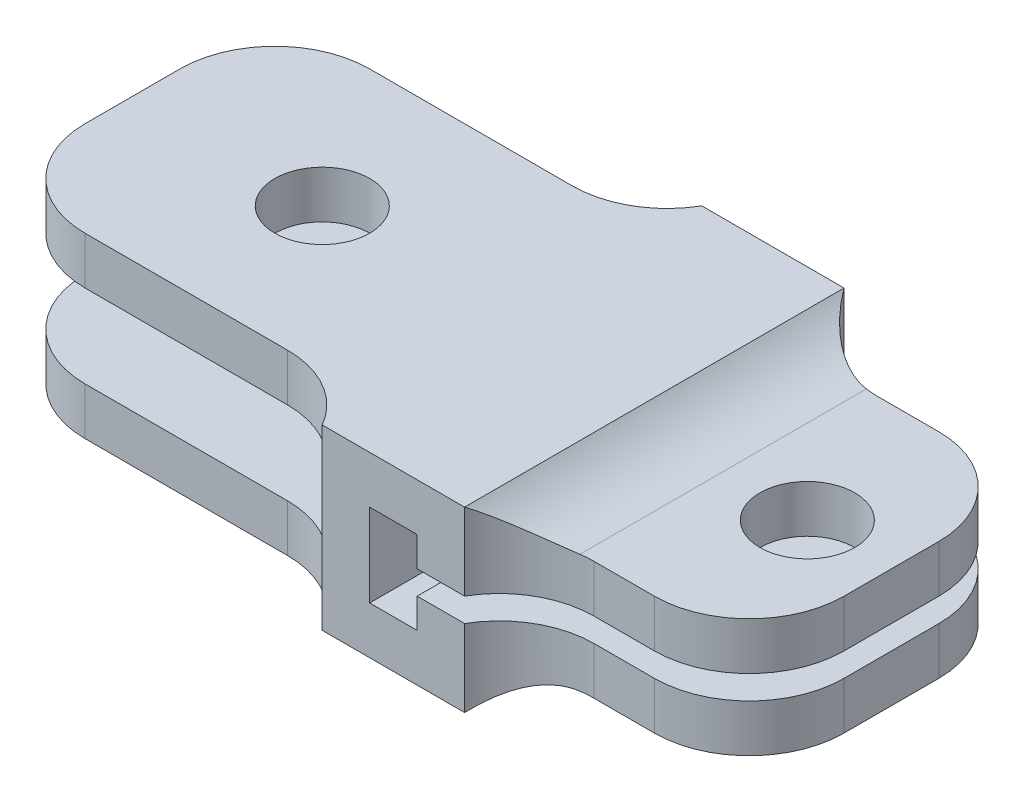
from build123d import *

# Parameters (mm, degrees)
SCHIZZO1_W                    = 15
SCHIZZO1_H                    = 18.75
SCHIZZO1_W_2                  = 5
SCHIZZO1_H_2                  = 8.75
ESTRUSIONE_ESTRUSIONE1_DEPTH  = 40
TAGLIO_ESTRUSIONE1_DEPTH      = 42.762909681
TAGLIO_ESTRUSIONE1_DEPTH_BACK = 42.762909681
SCHIZZO2_W                    = 5
SCHIZZO2_H                    = 2.5
SCHIZZO4_W                    = 30
SCHIZZO4_H                    = 5
ESTRUSIONE_ESTRUSIONE2_DEPTH  = 40
RACCORDO1_R                   = 10
SCHIZZO5_W                    = 30
SCHIZZO5_H                    = 5
ESTRUSIONE_ESTRUSIONE3_DEPTH  = 25
RACCORDO2_R                   = 10
RACCORDO3_R                   = 10
RACCORDO4_R                   = 10
RACCORDO5_R                   = 10
TAGLIO_ESTRUSIONE2_DEPTH      = 65.034292657
TAGLIO_ESTRUSIONE2_DEPTH_BACK = 65.034292657
SCHIZZO6_R                    = 5
TAGLIO_ESTRUSIONE3_DEPTH      = 65.867653817
TAGLIO_ESTRUSIONE3_DEPTH_BACK = 65.867653817
SCHIZZO7_R                    = 5


with BuildPart() as part:
    # Schizzo1 → Estrusione-Estrusione1 (new body)
    with BuildSketch(Plane.XY):
        Rectangle(SCHIZZO1_W, SCHIZZO1_H)
        Rectangle(SCHIZZO1_W_2, SCHIZZO1_H_2, mode=Mode.SUBTRACT)
    extrude(amount=ESTRUSIONE_ESTRUSIONE1_DEPTH)

    # Schizzo2 → Taglio-Estrusione1 (cut, two sides: drawn at the far end of the back side and taken through both)
    with BuildSketch(Plane.XY.offset(40).offset(-TAGLIO_ESTRUSIONE1_DEPTH_BACK)):
        with Locations((5, 0)):
            Rectangle(SCHIZZO2_W, SCHIZZO2_H)
    extrude(amount=TAGLIO_ESTRUSIONE1_DEPTH + TAGLIO_ESTRUSIONE1_DEPTH_BACK, mode=Mode.SUBTRACT)

    # Schizzo4 → Estrusione-Estrusione2 (add)
    with BuildSketch(Plane.ZY.offset(7.5)):
        with Locations((20, 6.875)):
            Rectangle(SCHIZZO4_W, SCHIZZO4_H)
        with Locations((20, -6.875)):
            Rectangle(SCHIZZO4_W, SCHIZZO4_H)
    extrude(amount=ESTRUSIONE_ESTRUSIONE2_DEPTH)

    # Raccordo1
    raccordo1_edges = [part.edges().sort_by_distance(p)[0] for p in [
        (-47.5, 6.875, 5),
        (-47.5, 6.875, 35),
        (-47.5, -6.875, 35),
        (-47.5, -6.875, 5),
    ]]
    fillet(raccordo1_edges, radius=RACCORDO1_R)

    # Schizzo5 → Estrusione-Estrusione3 (add)
    with BuildSketch(Plane(origin=(7.5, 0, 0), x_dir=(0, 0, -1), z_dir=(1, 0, 0))):
        with Locations((-20, 3.75)):
            Rectangle(SCHIZZO5_W, SCHIZZO5_H)
        with Locations((-20, -3.75)):
            Rectangle(SCHIZZO5_W, SCHIZZO5_H)
    extrude(amount=ESTRUSIONE_ESTRUSIONE3_DEPTH)

    # Raccordo2
    raccordo2_edges = [part.edges().sort_by_distance(p)[0] for p in [
        (32.5, 3.75, 35),
        (32.5, 3.75, 5),
        (32.5, -3.75, 35),
        (32.5, -3.75, 5),
    ]]
    fillet(raccordo2_edges, radius=RACCORDO2_R)

    # Raccordo3
    # the kernel refuses this fillet: 10 mm, written as the material it adds along each edge
    with BuildSketch(Plane(origin=(7.5, -6.25, 5), x_dir=(0, 0, -1), z_dir=(0, 1, 0)), Plane(origin=(7.5, 1.25, 5), x_dir=(0, 0, -1), z_dir=(0, 1, 0)), Plane(origin=(7.5, 6.25, 35), x_dir=(0, 0, 1), z_dir=(0, -1, 0))) as raccordo3_piece_1:
        with BuildLine():
            CenterArc((10, -8.660254038), RACCORDO3_R, 120, 60)
            Line((0, -8.660254038), (-0.2, -8.660254038))
            Line((-0.2, -8.660254038), (-0.2, 0))
            Line((-0.2, 0), (0, 0.2))
            ThreePointArc((0, 0.2), (2.5, 0.2), (4.9, 0.173205081))
            Line((4.9, 0.173205081), (5, 0))
        make_face()
    extrude(amount=5)
    with BuildSketch(Plane(origin=(7.5, -6.25, 5), x_dir=(0, 0, -1), z_dir=(0, 1, 0))) as raccordo3_piece_2_section:
        with BuildLine():
            CenterArc((10, -8.660254038), RACCORDO3_R, 120, 60)
            Line((0, -8.660254038), (-0.2, -8.660254038))
            Line((-0.2, -8.660254038), (-0.2, 0))
            Line((-0.2, 0), (0, 0.2))
            ThreePointArc((0, 0.2), (2.5, 0.2), (4.9, 0.173205081))
            Line((4.9, 0.173205081), (5, 0))
        make_face()
    raccordo3_piece_2 = extrude(amount=26.650635095, mode=Mode.PRIVATE)
    raccordo3_piece_2 = split(raccordo3_piece_2, bisect_by=Plane(origin=(9.663104458, 1.25, 3.704832889), z_dir=(0, 1, 0)), keep=Keep.TOP, mode=Mode.PRIVATE)
    raccordo3_piece_2 = split(raccordo3_piece_2, bisect_by=Plane(origin=(9.663104458, 6.25, 3.704832889), z_dir=(0, -1, 0)), keep=Keep.TOP, mode=Mode.PRIVATE)
    add(raccordo3_piece_2)
    with BuildSketch(Plane(origin=(7.5, -20.400635095, 5), x_dir=(0, 0, -1), z_dir=(0, 1, 0))) as raccordo3_piece_3_section:
        with BuildLine():
            CenterArc((10, -8.660254038), RACCORDO3_R, 120, 60)
            Line((0, -8.660254038), (-0.2, -8.660254038))
            Line((-0.2, -8.660254038), (-0.2, 0))
            Line((-0.2, 0), (0, 0.2))
            ThreePointArc((0, 0.2), (2.5, 0.2), (4.9, 0.173205081))
            Line((4.9, 0.173205081), (5, 0))
        make_face()
    raccordo3_piece_3 = extrude(amount=26.650635095, mode=Mode.PRIVATE)
    raccordo3_piece_3 = split(raccordo3_piece_3, bisect_by=Plane(origin=(9.663104458, -1.25, 3.704832889), z_dir=(0, -1, 0)), keep=Keep.TOP, mode=Mode.PRIVATE)
    raccordo3_piece_3 = split(raccordo3_piece_3, bisect_by=Plane(origin=(9.663104458, -6.25, 3.704832889), z_dir=(0, 1, 0)), keep=Keep.TOP, mode=Mode.PRIVATE)
    add(raccordo3_piece_3)
    with BuildSketch(Plane(origin=(7.5, 20.400635095, 35), x_dir=(1, 0, 0), z_dir=(0, -1, 0))) as raccordo3_piece_4_section:
        with BuildLine():
            CenterArc((8.660254038, 10), RACCORDO3_R, 210, 60)
            Line((0, 5), (-0.173205081, 4.9))
            ThreePointArc((-0.173205081, 4.9), (-0.2, 2.5), (-0.2, 0))
            Line((-0.2, 0), (0, -0.2))
            Line((0, -0.2), (8.660254038, -0.2))
            Line((8.660254038, -0.2), (8.660254038, 0))
        make_face()
    raccordo3_piece_4 = extrude(amount=26.650635095, mode=Mode.PRIVATE)
    raccordo3_piece_4 = split(raccordo3_piece_4, bisect_by=Plane(origin=(9.663104458, 1.25, 36.295167111), z_dir=(0, 1, 0)), keep=Keep.TOP, mode=Mode.PRIVATE)
    raccordo3_piece_4 = split(raccordo3_piece_4, bisect_by=Plane(origin=(9.663104458, 6.25, 36.295167111), z_dir=(0, -1, 0)), keep=Keep.TOP, mode=Mode.PRIVATE)
    add(raccordo3_piece_4)
    with BuildSketch(Plane(origin=(7.5, -1.25, 35), x_dir=(1, 0, 0), z_dir=(0, -1, 0))) as raccordo3_piece_5:
        with BuildLine():
            CenterArc((8.660254038, 10), RACCORDO3_R, 210, 60)
            Line((0, 5), (-0.173205081, 4.9))
            ThreePointArc((-0.173205081, 4.9), (-0.2, 2.5), (-0.2, 0))
            Line((-0.2, 0), (0, -0.2))
            Line((0, -0.2), (8.660254038, -0.2))
            Line((8.660254038, -0.2), (8.660254038, 0))
        make_face()
    extrude(amount=5)
    with BuildSketch(Plane(origin=(7.5, 6.25, 35), x_dir=(0, 0, 1), z_dir=(0, -1, 0))) as raccordo3_piece_6_section:
        with BuildLine():
            CenterArc((10, -8.660254038), RACCORDO3_R, 120, 60)
            Line((0, -8.660254038), (-0.2, -8.660254038))
            Line((-0.2, -8.660254038), (-0.2, 0))
            Line((-0.2, 0), (0, 0.2))
            ThreePointArc((0, 0.2), (2.5, 0.2), (4.9, 0.173205081))
            Line((4.9, 0.173205081), (5, 0))
        make_face()
    raccordo3_piece_6 = extrude(amount=26.650635095, mode=Mode.PRIVATE)
    raccordo3_piece_6 = split(raccordo3_piece_6, bisect_by=Plane(origin=(9.663104458, -1.25, 36.295167111), z_dir=(0, -1, 0)), keep=Keep.TOP, mode=Mode.PRIVATE)
    raccordo3_piece_6 = split(raccordo3_piece_6, bisect_by=Plane(origin=(9.663104458, -6.25, 36.295167111), z_dir=(0, 1, 0)), keep=Keep.TOP, mode=Mode.PRIVATE)
    add(raccordo3_piece_6)

    # Raccordo4
    # the kernel refuses this fillet: 10 mm, written as the material it adds along each edge
    with BuildSketch(Plane(origin=(7.5, 6.25, 0), x_dir=(1, 0, 0), z_dir=(0, 0, 1))) as raccordo4_piece_1_section:
        with BuildLine():
            CenterArc((7.261843774, 10), RACCORDO4_R, 223.432536558, 46.567463442)
            Line((0, 3.125), (-0.145236875, 2.9875))
            ThreePointArc((-0.145236875, 2.9875), (-0.2, 1.5625), (-0.2, 0))
            Line((-0.2, 0), (0, -0.2))
            Line((0, -0.2), (7.261843774, -0.2))
            Line((7.261843774, -0.2), (7.261843774, 0))
        make_face()
    raccordo4_piece_1 = extrude(amount=40, mode=Mode.PRIVATE)
    raccordo4_piece_1 = raccordo4_piece_1 - Plane(origin=(16.160254038, 7.063958932, -5), x_dir=(0, 0, -1), z_dir=(0, -1, 0)) * Cylinder(10, 110, mode=Mode.PRIVATE)
    raccordo4_piece_1 = raccordo4_piece_1 - Plane(origin=(16.160254038, 7.063958932, 45), x_dir=(0, 0, 1), z_dir=(0, 1, 0)) * Cylinder(10, 110, mode=Mode.PRIVATE)
    add(raccordo4_piece_1)
    with BuildSketch(Plane(origin=(7.5, -6.25, 40), x_dir=(1, 0, 0), z_dir=(0, 0, -1))) as raccordo4_piece_2_section:
        with BuildLine():
            CenterArc((7.261843774, 10), RACCORDO4_R, 223.432536558, 46.567463442)
            Line((0, 3.125), (-0.145236875, 2.9875))
            ThreePointArc((-0.145236875, 2.9875), (-0.2, 1.5625), (-0.2, 0))
            Line((-0.2, 0), (0, -0.2))
            Line((0, -0.2), (7.261843774, -0.2))
            Line((7.261843774, -0.2), (7.261843774, 0))
        make_face()
    raccordo4_piece_2 = extrude(amount=40, mode=Mode.PRIVATE)
    raccordo4_piece_2 = raccordo4_piece_2 - Plane(origin=(16.160254038, -7.063958932, 45), x_dir=(1, 0, 0), z_dir=(0, 1, 0)) * Cylinder(10, 110, mode=Mode.PRIVATE)
    raccordo4_piece_2 = raccordo4_piece_2 - Plane(origin=(16.160254038, -7.063958932, -5), x_dir=(0, 0, -1), z_dir=(0, -1, 0)) * Cylinder(10, 110, mode=Mode.PRIVATE)
    add(raccordo4_piece_2)

    # Raccordo5
    # the kernel refuses this fillet: 10 mm, written as the material it adds along each edge
    with BuildSketch(Plane(origin=(-7.5, 9.375, 35), x_dir=(-1, 0, 0), z_dir=(0, -1, 0))) as raccordo5_piece_1:
        with BuildLine():
            CenterArc((8.660254038, -10), RACCORDO5_R, 90, 60)
            Line((0, -5), (-0.173205081, -4.9))
            ThreePointArc((-0.173205081, -4.9), (-0.2, -2.5), (-0.2, 0))
            Line((-0.2, 0), (0, 0.2))
            Line((0, 0.2), (8.660254038, 0.2))
            Line((8.660254038, 0.2), (8.660254038, 0))
        make_face()
    extrude(amount=5)
    with BuildSketch(Plane(origin=(-7.5, 9.375, 35), x_dir=(-1, 0, 0), z_dir=(0, -1, 0))) as raccordo5_piece_2_section:
        with BuildLine():
            CenterArc((8.660254038, -10), RACCORDO5_R, 90, 60)
            Line((0, -5), (-0.173205081, -4.9))
            ThreePointArc((-0.173205081, -4.9), (-0.2, -2.5), (-0.2, 0))
            Line((-0.2, 0), (0, 0.2))
            Line((0, 0.2), (8.660254038, 0.2))
            Line((8.660254038, 0.2), (8.660254038, 0))
        make_face()
    raccordo5_piece_2 = extrude(amount=26.650635095, mode=Mode.PRIVATE)
    raccordo5_piece_2 = split(raccordo5_piece_2, bisect_by=Plane(origin=(-9.663104458, -9.375, 36.295167111), z_dir=(0, 1, 0)), keep=Keep.TOP, mode=Mode.PRIVATE)
    raccordo5_piece_2 = split(raccordo5_piece_2, bisect_by=Plane(origin=(-9.663104458, -4.375, 36.295167111), z_dir=(0, -1, 0)), keep=Keep.TOP, mode=Mode.PRIVATE)
    add(raccordo5_piece_2)
    with BuildSketch(Plane(origin=(-7.5, -17.275635095, 5), x_dir=(0, 0, -1), z_dir=(0, 1, 0))) as raccordo5_piece_3_section:
        with BuildLine():
            CenterArc((10, 8.660254038), RACCORDO5_R, 180, 60)
            Line((0, 8.660254038), (-0.2, 8.660254038))
            Line((-0.2, 8.660254038), (-0.2, 0))
            Line((-0.2, 0), (0, -0.2))
            ThreePointArc((0, -0.2), (2.5, -0.2), (4.9, -0.173205081))
            Line((4.9, -0.173205081), (5, 0))
        make_face()
    raccordo5_piece_3 = extrude(amount=26.650635095, mode=Mode.PRIVATE)
    raccordo5_piece_3 = split(raccordo5_piece_3, bisect_by=Plane(origin=(-9.663104458, -9.375, 3.704832889), z_dir=(0, 1, 0)), keep=Keep.TOP, mode=Mode.PRIVATE)
    raccordo5_piece_3 = split(raccordo5_piece_3, bisect_by=Plane(origin=(-9.663104458, -4.375, 3.704832889), z_dir=(0, -1, 0)), keep=Keep.TOP, mode=Mode.PRIVATE)
    add(raccordo5_piece_3)
    with BuildSketch(Plane(origin=(-7.5, 4.375, 5), x_dir=(0, 0, -1), z_dir=(0, 1, 0))) as raccordo5_piece_4:
        with BuildLine():
            CenterArc((10, 8.660254038), RACCORDO5_R, 180, 60)
            Line((0, 8.660254038), (-0.2, 8.660254038))
            Line((-0.2, 8.660254038), (-0.2, 0))
            Line((-0.2, 0), (0, -0.2))
            ThreePointArc((0, -0.2), (2.5, -0.2), (4.9, -0.173205081))
            Line((4.9, -0.173205081), (5, 0))
        make_face()
    extrude(amount=5)
    with BuildSketch(Plane(origin=(-7.5, 17.275635095, 5), x_dir=(0, 0, -1), z_dir=(0, -1, 0))) as raccordo5_piece_5_section:
        with BuildLine():
            CenterArc((10, -8.660254038), RACCORDO5_R, 120, 60)
            Line((0, -8.660254038), (-0.2, -8.660254038))
            Line((-0.2, -8.660254038), (-0.2, 0))
            Line((-0.2, 0), (0, 0.2))
            ThreePointArc((0, 0.2), (2.5, 0.2), (4.9, 0.173205081))
            Line((4.9, 0.173205081), (5, 0))
        make_face()
    raccordo5_piece_5 = extrude(amount=26.650635095, mode=Mode.PRIVATE)
    raccordo5_piece_5 = split(raccordo5_piece_5, bisect_by=Plane(origin=(-9.663104458, 9.375, 3.704832889), z_dir=(0, -1, 0)), keep=Keep.TOP, mode=Mode.PRIVATE)
    raccordo5_piece_5 = split(raccordo5_piece_5, bisect_by=Plane(origin=(-9.663104458, 4.375, 3.704832889), z_dir=(0, 1, 0)), keep=Keep.TOP, mode=Mode.PRIVATE)
    add(raccordo5_piece_5)
    with BuildSketch(Plane(origin=(-7.5, -4.375, 5), x_dir=(0, 0, -1), z_dir=(0, -1, 0)), Plane(origin=(-7.5, -9.375, 35), x_dir=(0, 0, 1), z_dir=(0, 1, 0))) as raccordo5_piece_6:
        with BuildLine():
            CenterArc((10, -8.660254038), RACCORDO5_R, 120, 60)
            Line((0, -8.660254038), (-0.2, -8.660254038))
            Line((-0.2, -8.660254038), (-0.2, 0))
            Line((-0.2, 0), (0, 0.2))
            ThreePointArc((0, 0.2), (2.5, 0.2), (4.9, 0.173205081))
            Line((4.9, 0.173205081), (5, 0))
        make_face()
    extrude(amount=5)
    with BuildSketch(Plane(origin=(-7.5, -9.375, 35), x_dir=(0, 0, 1), z_dir=(0, 1, 0))) as raccordo5_piece_7_section:
        with BuildLine():
            CenterArc((10, -8.660254038), RACCORDO5_R, 120, 60)
            Line((0, -8.660254038), (-0.2, -8.660254038))
            Line((-0.2, -8.660254038), (-0.2, 0))
            Line((-0.2, 0), (0, 0.2))
            ThreePointArc((0, 0.2), (2.5, 0.2), (4.9, 0.173205081))
            Line((4.9, 0.173205081), (5, 0))
        make_face()
    raccordo5_piece_7 = extrude(amount=26.650635095, mode=Mode.PRIVATE)
    raccordo5_piece_7 = split(raccordo5_piece_7, bisect_by=Plane(origin=(-9.663104458, 9.375, 36.295167111), z_dir=(0, -1, 0)), keep=Keep.TOP, mode=Mode.PRIVATE)
    raccordo5_piece_7 = split(raccordo5_piece_7, bisect_by=Plane(origin=(-9.663104458, 4.375, 36.295167111), z_dir=(0, 1, 0)), keep=Keep.TOP, mode=Mode.PRIVATE)
    add(raccordo5_piece_7)

    # Schizzo6 → Taglio-Estrusione2 (cut, two sides: drawn at the far end of the back side and taken through both)
    with BuildSketch(Plane(origin=(0, 6.25, 0), x_dir=(1, 0, 0), z_dir=(0, 1, 0)).offset(-TAGLIO_ESTRUSIONE2_DEPTH_BACK)):
        with Locations(Location((23.630921887, -20, 0), (0, 0, 270))):
            Circle(SCHIZZO6_R)
    extrude(amount=TAGLIO_ESTRUSIONE2_DEPTH + TAGLIO_ESTRUSIONE2_DEPTH_BACK, mode=Mode.SUBTRACT)

    # Schizzo7 → Taglio-Estrusione3 (cut, two sides: drawn at the far end of the back side and taken through both)
    with BuildSketch(Plane(origin=(0, 9.375, 0), x_dir=(1, 0, 0), z_dir=(0, 1, 0)).offset(-TAGLIO_ESTRUSIONE3_DEPTH_BACK)):
        with Locations(Location((-27.5, -20, 0), (0, 0, 270))):
            Circle(SCHIZZO7_R)
    extrude(amount=TAGLIO_ESTRUSIONE3_DEPTH + TAGLIO_ESTRUSIONE3_DEPTH_BACK, mode=Mode.SUBTRACT)


solid = part.part
